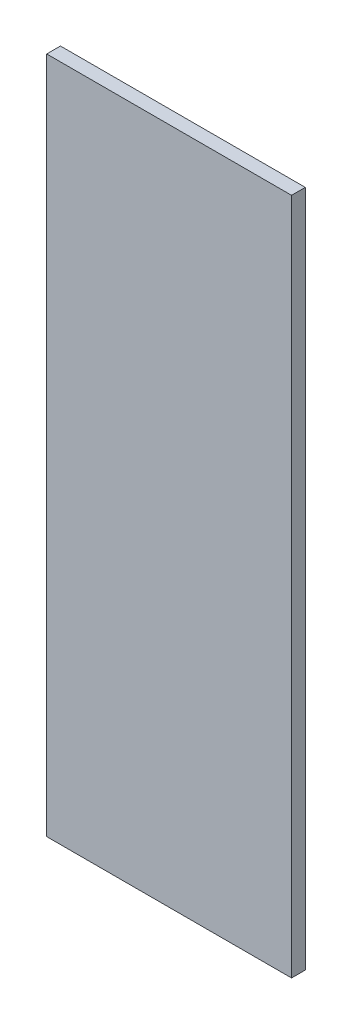
from build123d import *

# Parameters (mm, degrees)
SKETCH1_W           = 56.55
SKETCH1_H           = 156.55
BOSS_EXTRUDE1_DEPTH = 3.175


with BuildPart() as part:
    # Sketch1 → Boss-Extrude1 (new body)
    with BuildSketch(Plane.XY):
        Rectangle(SKETCH1_W, SKETCH1_H)
    extrude(amount=BOSS_EXTRUDE1_DEPTH)


solid = part.part
